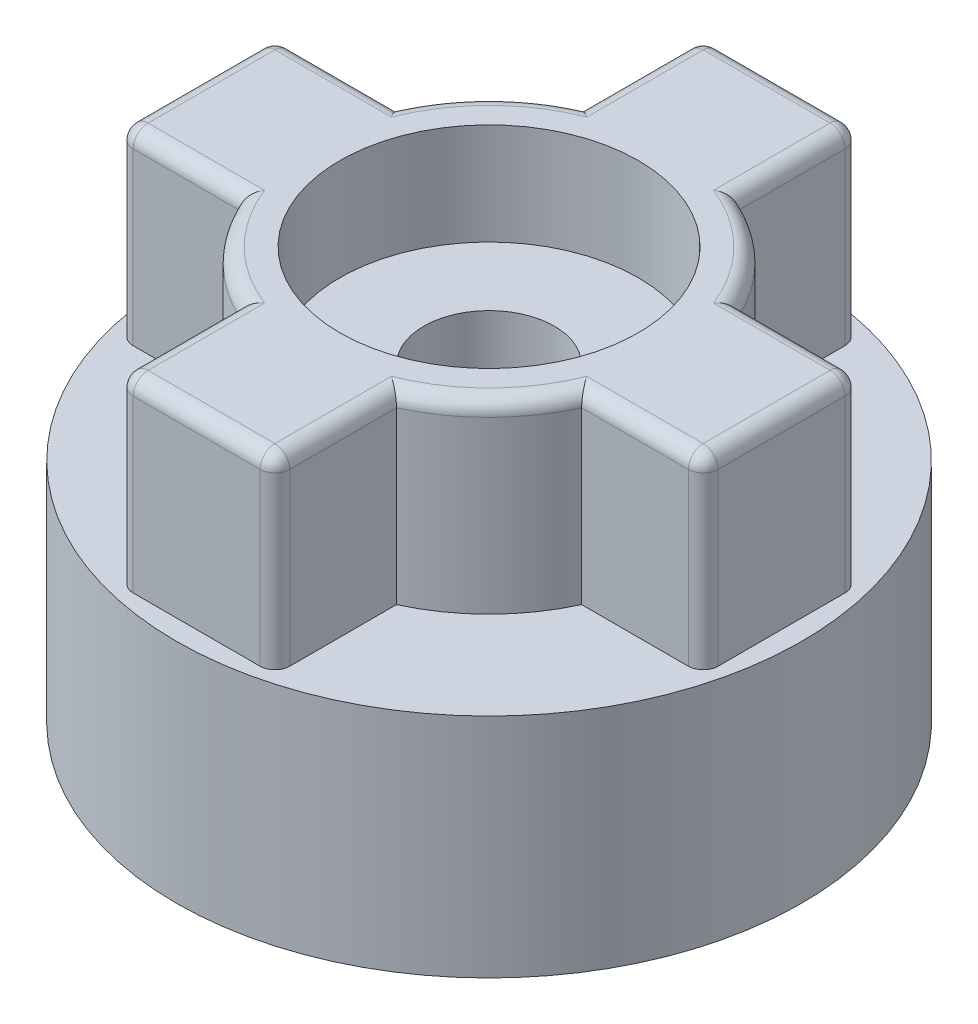
from build123d import *

# Parameters (mm, degrees)
SKETCH1_R           = 26.6192
BOSS_EXTRUDE1_DEPTH = 19.304
BOSS_EXTRUDE2_DEPTH = 15.7734
SKETCH3_R           = 12.7
CUT_EXTRUDE1_DEPTH  = 8.636
SKETCH4_R           = 5.55625
CUT_EXTRUDE2_DEPTH  = 47.003383041
FILLET1_R           = 1.27
FILLET2_R           = 1.27


with BuildPart() as part:
    # Sketch1 → Boss-Extrude1 (new body)
    with BuildSketch(Plane(origin=(0, 0, 0), x_dir=(1, 0, 0), z_dir=(0, 1, 0))):
        with Locations(Location((0, 0, 0), (0, 0, 270))):
            Circle(SKETCH1_R)
    extrude(amount=BOSS_EXTRUDE1_DEPTH)

    # Sketch2 → Boss-Extrude2 (add)
    with BuildSketch(Plane(origin=(0, 19.304, 0), x_dir=(1, 0, 0), z_dir=(0, 1, 0))):
        with BuildLine():
            Line((-6.6675, 14.546767605), (-6.6675, 24.892))
            Line((-6.6675, 24.892), (6.6675, 24.892))
            Line((6.6675, 24.892), (6.6675, 14.546767605))
            ThreePointArc((6.6675, 14.546767605), (11.315122713, 11.315122713), (14.546767605, 6.6675))
            Line((14.546767605, 6.6675), (24.892, 6.6675))
            Line((24.892, 6.6675), (24.892, -6.6675))
            Line((24.892, -6.6675), (14.546767605, -6.6675))
            ThreePointArc((14.546767605, -6.6675), (11.315122713, -11.315122713), (6.6675, -14.546767605))
            Line((6.6675, -14.546767605), (6.6675, -24.892))
            Line((6.6675, -24.892), (-6.6675, -24.892))
            Line((-6.6675, -24.892), (-6.6675, -14.546767605))
            ThreePointArc((-6.6675, -14.546767605), (-11.315122713, -11.315122713), (-14.546767605, -6.6675))
            Line((-14.546767605, -6.6675), (-24.892, -6.6675))
            Line((-24.892, -6.6675), (-24.892, 6.6675))
            Line((-24.892, 6.6675), (-14.546767605, 6.6675))
            ThreePointArc((-14.546767605, 6.6675), (-11.315122713, 11.315122713), (-6.6675, 14.546767605))
        make_face()
    extrude(amount=BOSS_EXTRUDE2_DEPTH)

    # Sketch3 → Cut-Extrude1 (cut)
    with BuildSketch(Plane(origin=(0, 35.0774, 0), x_dir=(1, 0, 0), z_dir=(0, 1, 0))):
        with Locations(Location((0, 0, 0), (0, 0, 270))):
            Circle(SKETCH3_R)
    extrude(amount=-CUT_EXTRUDE1_DEPTH, mode=Mode.SUBTRACT)

    # Sketch4 → Cut-Extrude2 (cut, through all)
    with BuildSketch(Plane(origin=(0, 26.4414, 0), x_dir=(1, 0, 0), z_dir=(0, 1, 0))):
        with Locations(Location((0, 0, 0), (0, 0, 270))):
            Circle(SKETCH4_R)
    extrude(amount=-CUT_EXTRUDE2_DEPTH, mode=Mode.SUBTRACT)

    # Fillet1
    fillet1_edges = [part.edges().sort_by_distance(p)[0] for p in [
        (-11.315122713, 35.0774, -11.315122713),
        (-19.719383802, 35.0774, -6.6675),
        (-24.892, 35.0774, 0),
        (-19.719383802, 35.0774, 6.6675),
        (-11.315122713, 35.0774, 11.315122713),
        (-6.6675, 35.0774, 19.719383802),
        (0, 35.0774, 24.892),
        (6.6675, 35.0774, 19.719383802),
        (11.315122713, 35.0774, 11.315122713),
        (19.719383802, 35.0774, 6.6675),
        (24.892, 35.0774, 0),
        (19.719383802, 35.0774, -6.6675),
        (11.315122713, 35.0774, -11.315122713),
        (6.6675, 35.0774, -19.719383802),
        (0, 35.0774, -24.892),
        (-6.6675, 35.0774, -19.719383802),
    ]]
    fillet(fillet1_edges, radius=FILLET1_R)

    # Fillet2
    # the kernel refuses this fillet: 1.27 mm, written as the material it takes off along each edge
    with BuildSketch(Plane(origin=(5.3975, 33.8074, -23.622), x_dir=(0, 0, -1), z_dir=(1, 0, 0))) as fillet2_piece_1_section:
        Polygon((0, 0), (FILLET2_R, 0), (FILLET2_R, FILLET2_R), (0, FILLET2_R), align=None)
    fillet2_piece_1 = extrude(amount=FILLET2_R, mode=Mode.PRIVATE)
    fillet2_piece_1 = fillet2_piece_1 - Plane(origin=(5.3975, 33.8074, -23.622), x_dir=(0, -0.7071067811865475, 0.7071067811865475), z_dir=(1, 0, 0)) * Sphere(FILLET2_R, mode=Mode.PRIVATE)
    add(fillet2_piece_1, mode=Mode.SUBTRACT)
    with BuildSketch(Plane(origin=(23.622, 33.8074, -5.3975), x_dir=(0, 0, -1), z_dir=(1, 0, 0))) as fillet2_piece_2_section:
        Polygon((0, 0), (FILLET2_R, 0), (FILLET2_R, FILLET2_R), (0, FILLET2_R), align=None)
    fillet2_piece_2 = extrude(amount=FILLET2_R, mode=Mode.PRIVATE)
    fillet2_piece_2 = fillet2_piece_2 - Plane(origin=(23.622, 33.8074, -5.3975), x_dir=(0, -0.7071067811865475, 0.7071067811865475), z_dir=(1, 0, 0)) * Sphere(FILLET2_R, mode=Mode.PRIVATE)
    add(fillet2_piece_2, mode=Mode.SUBTRACT)
    with BuildSketch(Plane(origin=(-5.3975, 33.8074, -23.622), x_dir=(0, 0, -1), z_dir=(-1, 0, 0))) as fillet2_piece_3_section:
        Polygon((0, 0), (FILLET2_R, 0), (FILLET2_R, -FILLET2_R), (0, -FILLET2_R), align=None)
    fillet2_piece_3 = extrude(amount=FILLET2_R, mode=Mode.PRIVATE)
    fillet2_piece_3 = fillet2_piece_3 - Plane(origin=(-5.3975, 33.8074, -23.622), x_dir=(0, -0.7071067811865475, 0.7071067811865475), z_dir=(-1, 0, 0)) * Sphere(FILLET2_R, mode=Mode.PRIVATE)
    add(fillet2_piece_3, mode=Mode.SUBTRACT)
    with BuildSketch(Plane(origin=(23.622, 33.8074, 5.3975), x_dir=(1, 0, 0), z_dir=(0, 0, 1))) as fillet2_piece_4_section:
        Polygon((0, 0), (FILLET2_R, 0), (FILLET2_R, FILLET2_R), (0, FILLET2_R), align=None)
    fillet2_piece_4 = extrude(amount=FILLET2_R, mode=Mode.PRIVATE)
    fillet2_piece_4 = fillet2_piece_4 - Plane(origin=(23.622, 33.8074, 5.3975), x_dir=(-0.7071067811865475, -0.7071067811865475, 0), z_dir=(0, 0, 1)) * Sphere(FILLET2_R, mode=Mode.PRIVATE)
    add(fillet2_piece_4, mode=Mode.SUBTRACT)
    with BuildSketch(Plane(origin=(-23.622, 33.8074, -5.3975), x_dir=(-1, 0, 0), z_dir=(0, 0, -1))) as fillet2_piece_5_section:
        Polygon((0, 0), (FILLET2_R, 0), (FILLET2_R, FILLET2_R), (0, FILLET2_R), align=None)
    fillet2_piece_5 = extrude(amount=FILLET2_R, mode=Mode.PRIVATE)
    fillet2_piece_5 = fillet2_piece_5 - Plane(origin=(-23.622, 33.8074, -5.3975), x_dir=(0.7071067811865475, -0.7071067811865475, 0), z_dir=(0, 0, -1)) * Sphere(FILLET2_R, mode=Mode.PRIVATE)
    add(fillet2_piece_5, mode=Mode.SUBTRACT)
    with BuildSketch(Plane(origin=(5.3975, 33.8074, 23.622), x_dir=(1, 0, 0), z_dir=(0, 0, 1))) as fillet2_piece_6_section:
        Polygon((0, 0), (FILLET2_R, 0), (FILLET2_R, FILLET2_R), (0, FILLET2_R), align=None)
    fillet2_piece_6 = extrude(amount=FILLET2_R, mode=Mode.PRIVATE)
    fillet2_piece_6 = fillet2_piece_6 - Plane(origin=(5.3975, 33.8074, 23.622), x_dir=(-0.7071067811865475, -0.7071067811865475, 0), z_dir=(0, 0, 1)) * Sphere(FILLET2_R, mode=Mode.PRIVATE)
    add(fillet2_piece_6, mode=Mode.SUBTRACT)
    with BuildSketch(Plane(origin=(-23.622, 33.8074, 5.3975), x_dir=(0, 0, 1), z_dir=(-1, 0, 0))) as fillet2_piece_7_section:
        Polygon((0, 0), (FILLET2_R, 0), (FILLET2_R, FILLET2_R), (0, FILLET2_R), align=None)
    fillet2_piece_7 = extrude(amount=FILLET2_R, mode=Mode.PRIVATE)
    fillet2_piece_7 = fillet2_piece_7 - Plane(origin=(-23.622, 33.8074, 5.3975), x_dir=(0, -0.7071067811865475, -0.7071067811865475), z_dir=(-1, 0, 0)) * Sphere(FILLET2_R, mode=Mode.PRIVATE)
    add(fillet2_piece_7, mode=Mode.SUBTRACT)
    with BuildSketch(Plane(origin=(-5.3975, 33.8074, 23.622), x_dir=(0, 0, 1), z_dir=(-1, 0, 0))) as fillet2_piece_8_section:
        Polygon((0, 0), (FILLET2_R, 0), (FILLET2_R, FILLET2_R), (0, FILLET2_R), align=None)
    fillet2_piece_8 = extrude(amount=FILLET2_R, mode=Mode.PRIVATE)
    fillet2_piece_8 = fillet2_piece_8 - Plane(origin=(-5.3975, 33.8074, 23.622), x_dir=(0, -0.7071067811865475, -0.7071067811865475), z_dir=(-1, 0, 0)) * Sphere(FILLET2_R, mode=Mode.PRIVATE)
    add(fillet2_piece_8, mode=Mode.SUBTRACT)
    with BuildSketch(Plane(origin=(-6.6675, 19.304, 24.892), x_dir=(0, 0, -1), z_dir=(0, 1, 0)), Plane(origin=(6.6675, 19.304, 24.892), x_dir=(-1, 0, 0), z_dir=(0, 1, 0)), Plane(origin=(24.892, 19.304, 6.6675), x_dir=(-1, 0, 0), z_dir=(0, 1, 0)), Plane(origin=(24.892, 19.304, -6.6675), x_dir=(0, 0, 1), z_dir=(0, 1, 0)), Plane(origin=(6.6675, 19.304, -24.892), x_dir=(0, 0, 1), z_dir=(0, 1, 0)), Plane(origin=(-24.892, 19.304, -6.6675), x_dir=(1, 0, 0), z_dir=(0, 1, 0)), Plane(origin=(-24.892, 19.304, 6.6675), x_dir=(0, 0, -1), z_dir=(0, 1, 0))) as fillet2_piece_9:
        with BuildLine():
            CenterArc((FILLET2_R, -FILLET2_R), FILLET2_R, 90, 90)
            Line((0, -FILLET2_R), (0, 0))
            Line((0, 0), (FILLET2_R, 0))
        make_face()
    extrude(amount=14.5034, mode=Mode.SUBTRACT)
    with BuildSketch(Plane(origin=(-6.6675, 19.304, -24.892), x_dir=(0, 0, 1), z_dir=(0, 1, 0))) as fillet2_piece_10:
        with BuildLine():
            CenterArc((FILLET2_R, FILLET2_R), FILLET2_R, 180, 90)
            Line((0, FILLET2_R), (0, 0))
            Line((0, 0), (FILLET2_R, 0))
        make_face()
    extrude(amount=14.5034, mode=Mode.SUBTRACT)


solid = part.part
